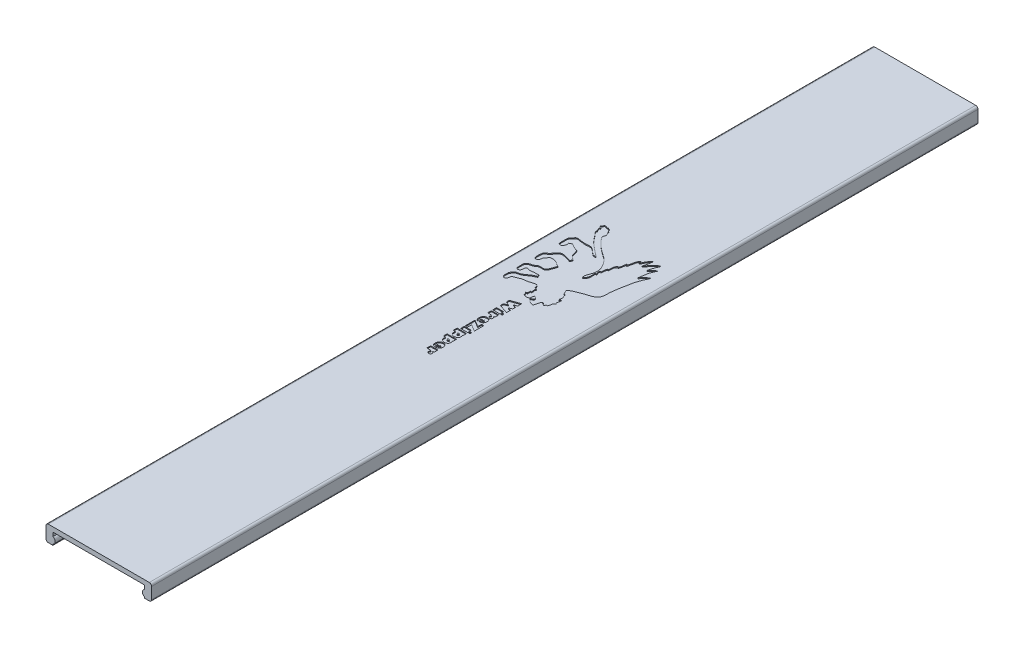
from build123d import *

# Parameters (mm, degrees)
BOSS_EXTRUDE1_DEPTH = 180
CUT_EXTRUDE1_DEPTH  = 0.2
CUT_EXTRUDE3_DEPTH  = 0.2


with BuildPart() as part:
    # Sketch1 → Boss-Extrude1 (new body)
    with BuildSketch(Plane.XY):
        with BuildLine():
            Line((21.5, 0), (22.5, 0))
            ThreePointArc((22.5, 0), (22.853553391, 0.146446609), (23, 0.5))
            Line((23, 0.5), (23, 3))
            ThreePointArc((23, 3), (22.853553391, 3.353553391), (22.5, 3.5))
            Line((22.5, 3.5), (0.5, 3.5))
            ThreePointArc((0.5, 3.5), (0.146446609, 3.353553391), (0, 3))
            Line((0, 3), (0, 0.5))
            ThreePointArc((0, 0.5), (0.146446609, 0.146446609), (0.5, 0))
            Line((0.5, 0), (1.5, 0))
            Line((1.5, 0), (1.5, 0.22281926))
            ThreePointArc((1.5, 0.22281926), (2, 0.929926042), (1.5, 1.637032823))
            Line((1.5, 1.637032823), (1.5, 2.5))
            Line((1.5, 2.5), (21.5, 2.5))
            Line((21.5, 2.5), (21.5, 1.637032823))
            ThreePointArc((21.5, 1.637032823), (21, 0.929926042), (21.5, 0.22281926))
            Line((21.5, 0.22281926), (21.5, 0))
        make_face()
    extrude(amount=BOSS_EXTRUDE1_DEPTH)

    # Sketch2 → Cut-Extrude1 (cut)
    with BuildSketch(Plane(origin=(0, 3.5, 0), x_dir=(1, 0, 0), z_dir=(0, 1, 0))):
        Polygon((19.745567043, -68.104601105), (19.771329957, -68.016192319), (19.70560115, -68.038746064), (19.64138336, -68.063779757), (19.578619421, -68.091182355), (19.517252165, -68.120842815), (19.457224424, -68.152650096), (19.39847903, -68.186493155), (19.340958816, -68.22226095), (19.284606615, -68.25984244), (19.229365259, -68.299126581), (19.175177579, -68.340002332), (19.12198641, -68.382358651), (19.069734583, -68.426084496), (19.018364931, -68.471068823), (18.918043479, -68.564368759), (18.772748422, -68.710981234), (18.269777505, -69.271361386), (18.281217218, -69.152948654), (18.534959056, -67.569138215), (18.544005901, -67.509503112), (18.554730191, -67.450416977), (18.56703761, -67.391848979), (18.580833842, -67.333768285), (18.612515474, -67.218945481), (18.649020551, -67.105701905), (18.711171581, -66.93825803), (19.047435047, -66.172036884), (19.133726594, -65.94994016), (19.076628488, -65.960005663), (19.0210055, -65.972912087), (18.966794939, -65.988522881), (18.913934115, -66.006701499), (18.862360336, -66.027311391), (18.812010911, -66.05021601), (18.762823149, -66.075278807), (18.71473436, -66.102363235), (18.667681851, -66.131332743), (18.621602933, -66.162050786), (18.576434914, -66.194380813), (18.532115103, -66.228186277), (18.445769342, -66.299677323), (18.362064121, -66.375431536), (18.200569188, -66.535359923), (17.84770658, -66.896305725), (17.884657267, -66.736955957), (17.968344054, -66.421133138), (18.063839559, -66.108907692), (18.225973101, -65.646689184), (18.633040198, -64.666178627), (18.599411796, -64.669771971), (18.533227498, -64.680575674), (18.468456628, -64.695924518), (18.405079291, -64.715485446), (18.312582633, -64.751995932), (18.2231095, -64.796110162), (18.080524168, -64.883478066), (17.794211119, -65.113398916), (17.069099288, -65.909145003), (16.828722484, -66.241607928), (16.513006588, -66.656341035), (16.794160411, -65.369006265), (16.941861286, -64.59631034), (16.870777867, -64.636264025), (16.802816891, -64.679249232), (16.737833191, -64.725113573), (16.675681599, -64.773704659), (16.616216947, -64.824870101), (16.559294067, -64.87845751), (16.504767792, -64.934314498), (16.452492954, -64.992288676), (16.402324385, -65.052227654), (16.354116917, -65.113979045), (16.307725383, -65.177390459), (16.263004615, -65.242309509), (16.219809445, -65.308583804), (16.177994705, -65.376060956), (16.097925845, -65.514014276), (15.98454659, -65.726155966), (15.693970925, -66.293387042), (15.617711182, -66.428936729), (15.54903134, -65.848423204), (15.522460267, -65.865064365), (15.472343148, -65.901302245), (15.426048379, -65.941194805), (15.383322735, -65.984398764), (15.34391299, -66.030570845), (15.290461754, -66.104643271), (15.228435653, -66.210590997), (15.076480483, -66.580017015), (15.040869472, -66.693542611), (14.686293126, -68.258406048), (14.474940792, -67.937489416), (14.445551284, -68.104829917), (14.310577684, -68.947591988), (14.271183579, -69.113223294), (14.240015457, -69.222374291), (14.204192452, -69.330305289), (14.163088355, -69.436841345), (14.140360206, -69.489531601), (14.116076957, -69.541807517), (13.981394714, -69.409464834), (13.758050972, -69.632820298), (13.676716055, -69.754194358), (13.642544144, -69.830846835), (13.624269592, -69.89243466), (13.614813809, -69.932350891), (13.591969798, -70.052722709), (13.568864821, -70.255035201), (13.529664818, -71.070500793), (13.334094675, -70.96058259), (13.302168255, -71.042533388), (13.24802945, -71.209136729), (13.206156478, -71.378791597), (13.169809605, -71.594144463), (13.14752875, -71.855680811), (13.149463132, -72.206015635), (12.963703448, -72.245338409), (12.919499216, -72.274044131), (12.898916729, -72.298983789), (12.888280793, -72.319488077), (12.880455427, -72.34346579), (12.874040289, -72.372947136), (12.865584292, -72.431757942), (12.862523692, -72.490347444), (12.864334122, -72.548693093), (12.870491214, -72.606772342), (12.893747912, -72.722041444), (13.055767611, -73.167952174), (12.76260984, -73.058920113), (12.772836021, -74.2235194), (12.769441063, -74.267985594), (12.764247026, -74.311940293), (12.757306122, -74.355374587), (12.748670559, -74.398279565), (12.738392549, -74.440646318), (12.7265243, -74.482465934), (12.713118023, -74.523729503), (12.698225927, -74.564428116), (12.681900222, -74.604552862), (12.664193119, -74.644094829), (12.624843556, -74.721394791), (12.580594918, -74.796256719), (12.531864882, -74.868609329), (12.479071129, -74.938381339), (12.422631337, -75.005501468), (12.332049001, -75.10105345), (12.235612524, -75.190237731), (12.134731573, -75.272813733), (12.046286421, -74.820815745), (12.0572263, -74.751406038), (12.070060076, -74.682497303), (12.08463885, -74.614050506), (12.100813721, -74.546026613), (12.137356163, -74.411091404), (12.200418082, -74.210884521), (12.455179307, -73.483307548), (12.495149159, -73.349414391), (12.530187067, -73.214246266), (12.545484294, -73.146086506), (12.559101837, -73.077490902), (12.570890798, -73.008420419), (12.580702278, -72.938836025), (12.588387376, -72.868698685), (12.59464246, -72.810642899), (12.603824389, -72.694131792), (12.608519809, -72.577268101), (12.608670092, -72.460267982), (12.604216612, -72.343347591), (12.595100741, -72.226723086), (12.581263852, -72.110610622), (12.562647316, -71.995226355), (12.539192508, -71.880786442), (12.510840798, -71.767507038), (12.47753356, -71.655604302), (12.439212167, -71.545294387), (12.39581799, -71.436793452), (12.347292403, -71.330317652), (12.293576778, -71.226083144), (12.153611462, -70.972593632), (12.055622325, -70.8055721), (11.953676271, -70.640627802), (11.847590064, -70.478189353), (11.737180466, -70.318685371), (11.622264242, -70.162544472), (11.563058883, -70.085869122), (11.502658155, -70.010195274), (11.441039151, -69.935576505), (11.378178968, -69.862066392), (11.314054701, -69.789718512), (11.248643446, -69.718586443), (11.181922298, -69.648723762), (11.113868352, -69.580184045), (11.044458704, -69.513020869), (10.973670449, -69.447287813), (10.901480682, -69.383038452), (10.8278665, -69.320326365), (10.752804998, -69.259205127), (10.676273271, -69.199728316), (10.598248414, -69.14194951), (10.518707523, -69.085922285), (9.445158783, -68.330045283), (9.377323265, -68.286704215), (8.529964041, -67.61150044), (8.336111467, -67.454739788), (8.147528972, -67.291868199), (7.90408908, -67.065842996), (7.669551492, -66.830496664), (7.443649508, -66.586710778), (7.173009545, -66.271453322), (6.864769026, -65.879980377), (6.709729802, -65.656858788), (6.656644684, -65.543795663), (6.640724685, -65.474324633), (6.637953976, -65.419306649), (6.637039488, -65.393399508), (6.637876621, -65.367752405), (6.640315856, -65.342344663), (6.649402561, -65.292164545), (6.663103453, -65.24269372), (6.767484106, -64.975890107), (6.787730528, -64.902361955), (6.795283594, -64.852609955), (6.796828208, -64.827451949), (6.796685517, -64.802078367), (6.794706002, -64.77646853), (6.790740146, -64.75060176), (6.78463843, -64.724457376), (6.776251336, -64.698014701), (6.478949583, -63.833852049), (6.316198754, -63.871944585), (6.081407246, -63.266668763), (5.943714714, -63.442255947), (5.617870925, -63.080333737), (5.499302591, -63.247135679), (5.418185032, -63.212665539), (5.083167801, -63.109789756), (4.852038362, -63.078852692), (4.675548278, -63.079290725), (4.667182278, -63.332341528), (4.3028609, -63.683744915), (4.436380901, -63.74543469), (4.682235799, -63.862000094), (4.740558774, -63.903978471), (4.775654331, -63.93618192), (4.807122862, -63.972386928), (4.821336845, -63.992158035), (4.834451894, -64.013131153), (4.846403949, -64.035373491), (4.857128952, -64.058952255), (4.866562843, -64.083934652), (4.619415738, -64.138096574), (4.636424293, -64.21830065), (4.696572924, -64.397852828), (4.954743423, -64.842439101), (4.882509129, -65.057092669), (4.880850914, -65.175763412), (4.901269108, -65.22048276), (4.962643763, -65.325273315), (5.32889596, -65.714175511), (5.354305854, -65.737196295), (5.426177903, -65.809786685), (5.534157903, -65.940347595), (5.924220438, -66.497400316), (5.994118086, -66.591179891), (6.065464319, -66.683663429), (6.138209009, -66.774888771), (6.212302028, -66.86489376), (6.287693249, -66.953716237), (6.364332545, -67.041394044), (6.442169787, -67.127965023), (6.521154849, -67.213467015), (6.601237603, -67.297937861), (6.764495676, -67.463937487), (6.931542986, -67.626266632), (7.101978513, -67.785228032), (7.275401236, -67.94112442), (7.540259084, -68.169884333), (8.356211579, -68.829090573), (8.39965809, -68.870721216), (8.488690302, -68.951152824), (8.626852738, -69.065704523), (8.914944993, -69.279321314), (9.595664905, -69.767475131), (9.73351794, -69.882958951), (9.238387712, -69.912079265), (9.122579566, -69.898059871), (9.054333719, -69.880159565), (8.905920839, -69.767554214), (7.90154777, -68.93355232), (7.651348823, -68.749684369), (7.602203888, -68.718777787), (7.552316259, -68.691274341), (7.501727456, -68.667008821), (7.450479005, -68.645816018), (7.398612426, -68.627530719), (7.346169242, -68.611987715), (7.293190978, -68.599021796), (7.239719154, -68.588467749), (7.185795294, -68.580160366), (7.13146092, -68.573934435), (7.076757555, -68.569624746), (7.021726722, -68.567066089), (6.910848742, -68.566541025), (6.743113827, -68.5747559), (6.185203457, -68.626466799), (6.076335393, -68.631387665), (4.991956592, -68.53259847), (4.861058435, -68.514729341), (4.366578875, -68.439300904), (4.267682616, -68.437779177), (4.201866854, -68.441828587), (4.136175391, -68.450643686), (4.070635862, -68.464836967), (4.037931708, -68.474141829), (4.01404608, -68.482781016), (3.991237496, -68.492646738), (3.969449153, -68.503673451), (3.92870599, -68.528947679), (3.891362185, -68.558079357), (3.856963332, -68.590544139), (3.780868317, -68.68284742), (3.574977655, -68.983157009), (3.510176489, -69.065065577), (3.25557439, -69.337636123), (3.211351075, -69.401747679), (3.186726578, -69.44712548), (3.166822765, -69.495060225), (3.158864646, -69.520106327), (3.152354934, -69.545935514), (3.147383041, -69.572595737), (3.14403838, -69.600134946), (3.139952782, -69.65652541), (3.140584749, -71.23861477), (3.144107239, -71.277524794), (3.183718199, -71.405349389), (3.229265505, -71.469694649), (3.269232129, -71.502636865), (3.304427669, -71.520476277), (3.344216436, -71.53134745), (3.61837653, -71.551970824), (3.709675015, -71.543297562), (3.775331899, -71.528081984), (3.817132856, -71.512976279), (3.856966272, -71.493394454), (3.894496742, -71.468902338), (3.91229356, -71.454679244), (3.929388866, -71.439065763), (3.945740734, -71.422007625), (3.961307239, -71.403450559), (3.98937849, -71.373627764), (4.015892902, -71.342811256), (4.040860808, -71.311051795), (4.064292537, -71.278400145), (4.086198421, -71.244907065), (4.106588791, -71.210623319), (4.125473977, -71.175599669), (4.142864311, -71.139886875), (4.158770122, -71.1035357), (4.173201743, -71.066596906), (4.186169503, -71.029121254), (4.197683734, -70.991159506), (4.207754767, -70.952762424), (4.216392932, -70.91398077), (4.223608561, -70.874865306), (4.233813531, -70.795835993), (4.238452325, -70.71608058), (4.237607589, -70.636005163), (4.23136197, -70.556015834), (4.219798116, -70.476518688), (4.202998672, -70.397919821), (4.181046286, -70.320625326), (4.790131131, -70.048376237), (5.224468095, -70.346633618), (5.475077196, -70.486742868), (5.64836071, -70.567299985), (5.78185668, -70.619673541), (5.91856101, -70.664295823), (6.011559556, -70.689357225), (6.441244971, -70.804155975), (6.680255914, -71.473471612), (6.700440152, -71.528410734), (6.744214516, -71.698966386), (6.8305612, -72.101378224), (6.861817271, -72.18289268), (6.887686976, -72.235415575), (6.918328723, -72.286218549), (6.970050687, -72.344544556), (7.108551306, -72.480415089), (7.793872115, -72.991890375), (7.735132038, -73.15174023), (7.645154274, -73.31873513), (7.592514427, -73.38335033), (7.546532614, -73.426319923), (7.494231265, -73.463718165), (7.455521087, -73.485171093), (6.985274076, -73.317712497), (6.413893192, -73.140189722), (6.218812671, -73.098385977), (6.070290228, -73.075536206), (6.002042209, -73.066146668), (5.611704265, -73.021744922), (5.505306074, -73.022135986), (5.435448501, -73.027843033), (5.366821867, -73.038771649), (5.333069605, -73.046425607), (5.299744422, -73.055662833), (5.266886098, -73.06657595), (5.234534417, -73.079257584), (5.202729158, -73.093800359), (5.171510104, -73.110296901), (5.140917036, -73.128839834), (5.110989736, -73.149521784), (5.081767984, -73.172435374), (5.038848794, -73.208166122), (4.914287773, -73.319608788), (4.718279149, -73.517061407), (3.986003167, -74.357903796), (3.433483796, -74.798544394), (3.243243612, -74.988383245), (3.204221159, -75.132149523), (3.132588262, -75.845942829), (3.130799477, -76.252818038), (3.148654304, -76.422002715), (3.168852255, -76.521067461), (3.187151588, -76.585602228), (3.209812025, -76.648656325), (3.237256891, -76.709994933), (3.269909511, -76.769383233), (3.288321017, -76.798272638), (3.329155607, -76.818994217), (3.393163804, -76.84288409), (3.45976748, -76.858628273), (3.551225161, -76.86789309), (3.643973908, -76.864941433), (3.781363878, -76.840439001), (3.931373466, -76.786619478), (3.950191496, -76.76983757), (3.967597017, -76.752250032), (3.983658702, -76.733899947), (4.012025244, -76.695084471), (4.035840485, -76.653735812), (4.055653791, -76.610198638), (4.085472057, -76.517937421), (4.154540692, -76.130285695), (4.157762673, -76.099856406), (4.162628318, -76.070279244), (4.169049296, -76.041508503), (4.176937276, -76.013498481), (4.196760928, -75.959577778), (4.221392631, -75.908151502), (4.265809513, -75.834889324), (4.488060664, -75.565058469), (4.592547696, -75.426797706), (4.768640496, -75.176910233), (4.823399979, -75.126278587), (4.869821171, -75.095667931), (4.903789049, -75.079559916), (4.940466976, -75.067384508), (4.98010671, -75.059564567), (5.021954842, -75.04726225), (5.063804833, -75.037016268), (5.105652668, -75.028734313), (5.147494334, -75.022324076), (5.189325817, -75.017693247), (5.231143104, -75.014749518), (5.272942181, -75.01340058), (5.314719033, -75.013554125), (5.398190011, -75.017999424), (5.481523927, -75.027346945), (5.606197568, -75.048944486), (6.179790772, -75.200372854), (6.239633866, -75.219128046), (6.296962677, -75.242394957), (6.379011919, -75.284391349), (6.533269842, -75.386216596), (6.862349187, -75.617843215), (6.945037614, -75.659721778), (7.352869278, -75.847349819), (7.335319283, -75.927703013), (7.254192511, -76.202650419), (6.985260636, -76.976985108), (6.921800835, -77.174822227), (6.841723584, -77.37132666), (6.79270217, -77.464611689), (6.755947017, -77.523748635), (6.715552076, -77.579825402), (6.671191275, -77.632312519), (6.647421778, -77.657044497), (6.622538539, -77.680680511), (6.596500797, -77.703154375), (6.569267795, -77.724399905), (6.540798772, -77.744350918), (6.511052969, -77.76294123), (6.479989628, -77.780104655), (6.447567989, -77.795775011), (6.40560176, -77.808651938), (6.363432271, -77.819535485), (6.321073302, -77.828565942), (6.278538629, -77.835883599), (6.235842032, -77.841628747), (6.150018177, -77.848962676), (6.020412416, -77.85167701), (5.541917787, -77.834166794), (5.41216609, -77.838595989), (5.326210196, -77.84748146), (5.283437156, -77.854124869), (5.240819091, -77.862422447), (5.198369779, -77.872514485), (5.142932417, -77.892932147), (5.037240988, -77.94319646), (4.595508909, -78.232665262), (4.465771592, -78.301295382), (4.414079725, -78.328559934), (4.360843257, -78.35123264), (4.250771412, -78.385854041), (3.854897238, -78.474529346), (3.773689965, -78.503975684), (3.721286266, -78.528674252), (3.670571997, -78.55831699), (3.616155246, -78.595331521), (3.217410772, -79.00059091), (3.19317992, -79.036269035), (3.173696418, -79.073379124), (3.152297456, -79.131367032), (3.135794606, -79.212150909), (3.130301383, -79.59056065), (3.131677235, -79.625378652), (3.13515924, -80.361202792), (3.153164243, -80.499456743), (3.175475562, -80.602089762), (3.194897118, -80.632702863), (3.216551099, -80.660694146), (3.240262865, -80.686093336), (3.265857778, -80.70893016), (3.2931612, -80.729234343), (3.32199849, -80.747035611), (3.35219501, -80.762363689), (3.383576122, -80.775248304), (3.415967186, -80.785719181), (3.449193564, -80.793806045), (3.483080616, -80.799538623), (3.517453704, -80.80294664), (3.552138188, -80.804059822), (3.586959431, -80.802907895), (3.621742792, -80.799520584), (3.656313633, -80.793927616), (3.690497316, -80.786158715), (3.724119201, -80.776243608), (3.757004649, -80.76421202), (3.788979022, -80.750093677), (3.819867681, -80.733918305), (3.849495986, -80.71571563), (3.877689299, -80.695515377), (3.90427298, -80.673347272), (3.929072392, -80.649241041), (3.951912895, -80.62322641), (3.97261985, -80.595333103), (3.991018618, -80.565590848), (4.006934561, -80.534029369), (4.026658772, -80.468509876), (4.041958321, -80.401577975), (4.093602475, -79.987461307), (4.118134233, -79.851994599), (4.136012084, -79.786120475), (4.158887552, -79.72189382), (4.17249384, -79.690493915), (4.187702868, -79.659620623), (4.204632414, -79.629312193), (4.223400257, -79.599606872), (4.244124176, -79.57054291), (4.294322886, -79.560046044), (4.394477249, -79.549496262), (4.519018866, -79.553175896), (4.956959152, -79.660275724), (4.993137986, -79.67044278), (5.029338755, -79.678827737), (5.06556032, -79.685532985), (5.10180154, -79.690660915), (5.138061278, -79.694313918), (5.210631748, -79.697604709), (5.283262616, -79.696224487), (5.392302227, -79.687187846), (5.901775676, -79.611653552), (6.010888162, -79.605724838), (6.910724574, -79.583092112), (7.079993608, -79.979697301), (6.960640786, -80.018349236), (6.843254235, -80.061514076), (6.727725219, -80.108861548), (6.557676714, -80.187002723), (6.391196025, -80.272697043), (6.17413742, -80.396778888), (5.497482708, -80.847161933), (5.050235161, -81.163132955), (4.845481788, -81.276636507), (4.702724052, -81.339200331), (4.591832195, -81.377593303), (4.515905719, -81.398582916), (3.962451456, -81.509870343), (3.836287705, -81.55399255), (3.763557986, -81.589752309), (3.421766696, -82.024454199), (3.230115071, -82.262994818), (3.189620962, -82.341215118), (3.174230893, -82.391897064), (3.168589007, -82.427579253), (3.16714966, -82.464962643), (3.169082441, -83.369377327), (3.171152539, -83.404791173), (3.176253231, -83.439743518), (3.184234647, -83.474111917), (3.194946916, -83.507773927), (3.208240169, -83.540607104), (3.223964534, -83.572489007), (3.241970142, -83.60329719), (3.262107121, -83.632909211), (3.284225601, -83.661202627), (3.308175713, -83.688054993), (3.333807585, -83.713343867), (3.360971347, -83.736946806), (3.389517129, -83.758741365), (3.41929506, -83.778605102), (3.45015527, -83.796415573), (3.481947888, -83.812050335), (3.514523044, -83.825386944), (3.547730868, -83.836302957), (3.581421489, -83.844675931), (3.615445037, -83.850383422), (3.649651641, -83.853302987), (3.683891431, -83.853312183), (3.718014536, -83.850288566), (3.751871086, -83.844109693), (3.785311211, -83.834653121), (3.81818504, -83.821796405), (3.850342703, -83.805417104), (3.881634329, -83.785392772), (3.911910048, -83.761600968), (3.941627115, -83.738549129), (3.968555703, -83.714125817), (3.992849747, -83.688409762), (4.014663184, -83.66147969), (4.034149948, -83.633414329), (4.051463973, -83.604292407), (4.066759197, -83.574192652), (4.080189553, -83.543193792), (4.091908977, -83.511374553), (4.102071403, -83.478813665), (4.110830768, -83.445589854), (4.124756052, -83.377468376), (4.162536714, -83.023853064), (4.178529719, -82.921216849), (4.194234668, -82.855645098), (4.204061831, -82.823951123), (5.709166827, -82.208816781), (5.745468392, -82.195717217), (5.818706943, -82.173175852), (5.929944577, -82.147271155), (6.156009482, -82.115763661), (6.687170783, -82.058997138), (6.798940154, -82.033761003), (6.921100642, -82.008515318), (7.102783459, -81.963377734), (7.942165958, -81.715913405), (8.123883521, -81.672704643), (8.246073986, -81.64912304), (8.369302006, -81.630693129), (8.431358997, -81.623670497), (8.493740054, -81.618248314), (8.556466735, -81.614530755), (8.872641196, -82.023266092), (8.847383583, -82.360020721), (9.365290519, -82.508550236), (9.235963053, -82.755180236), (9.30174099, -82.920386313), (9.291343064, -82.965881161), (9.283217409, -83.033851223), (9.283864284, -83.124082108), (9.357134099, -83.57422359), (9.058292573, -83.474445045), (9.070313767, -84.164851175), (8.674314613, -84.279138404), (9.075376023, -84.693660343), (9.004267543, -84.946211574), (9.797893144, -85.091875963), (10.299309972, -84.918726798), (10.302590804, -84.888892866), (10.362134706, -84.257198502), (10.392402408, -84.140493295), (10.4238157, -84.054795842), (10.452761583, -84.053395865), (10.48270627, -84.054232149), (10.513454488, -84.057230867), (10.544810964, -84.062318192), (10.576580425, -84.069420299), (10.608567599, -84.078463359), (10.640577212, -84.089373546), (10.672413991, -84.102077034), (10.703882664, -84.116499996), (10.734787958, -84.132568605), (10.764934599, -84.150209034), (10.794127315, -84.169347457), (10.822170833, -84.189910047), (10.84886988, -84.211822978), (10.874029183, -84.235012421), (10.897453468, -84.259404552), (10.918947464, -84.284925543), (10.938315897, -84.311501567), (10.955363494, -84.339058797), (10.969894983, -84.367523408), (10.98171509, -84.396821571), (10.990628542, -84.426879461), (10.996440067, -84.457623251), (10.998954391, -84.488979114), (10.997976242, -84.520873223), (10.993310347, -84.553231752), (10.984761433, -84.585980873), (10.972134227, -84.619046761), (10.955233455, -84.652355588), (10.946900708, -84.675901271), (10.937122571, -84.697505549), (10.925975944, -84.717267722), (10.913537725, -84.735287091), (10.899884813, -84.751662955), (10.885094105, -84.766494615), (10.869242501, -84.779881371), (10.852406898, -84.791922524), (10.834664196, -84.802717374), (10.796765085, -84.820965366), (10.735035629, -84.841472587), (10.468766526, -84.891767434), (10.407742715, -84.909813177), (10.632654551, -85.215101293), (10.856289859, -85.482768493), (10.94391904, -85.559685488), (11.007478361, -85.597529103), (11.238912997, -85.713053186), (11.51691899, -85.814885234), (11.949543592, -85.913752266), (12.142914428, -85.340516337), (12.268622202, -84.704727993), (12.270172263, -84.682613028), (12.273394104, -84.661654343), (12.278202913, -84.641799733), (12.284513875, -84.622996995), (12.292242176, -84.605193922), (12.301303003, -84.588338312), (12.32308298, -84.55726066), (12.349175294, -84.529346403), (12.378901438, -84.504177905), (12.428819842, -84.470659881), (12.682407584, -84.342088626), (12.736615276, -84.712836608), (13.058275473, -84.546878528), (13.138678392, -84.839029217), (13.15619516, -84.830826961), (13.188655655, -84.812000098), (13.231520718, -84.778313524), (13.27949892, -84.724938588), (13.440817098, -84.41633767), (13.632120999, -84.500552553), (13.75384145, -84.259790443), (13.818074028, -84.056258307), (13.84273201, -83.897648818), (13.845714599, -83.761784673), (13.855415492, -83.734454161), (13.889406923, -83.655010608), (13.944616533, -83.554313431), (14.320152096, -83.076569037), (14.06605127, -82.885197209), (14.098786875, -82.818870429), (14.141116363, -82.717192121), (14.175841778, -82.613213385), (14.211333893, -82.471629225), (14.244252884, -82.254702703), (14.255583412, -81.85169457), (13.769921082, -82.077886878), (13.767131001, -81.988319314), (13.774855998, -81.869942166), (13.859551467, -81.343553664), (13.863599826, -81.226018561), (13.63271354, -80.803171682), (13.598279053, -80.702891724), (13.581417493, -80.624274459), (13.575291626, -80.569914619), (13.573784579, -80.513793389), (13.044000725, -80.267249877), (13.143231585, -80.107359869), (12.879349072, -79.691964097), (12.846268149, -79.593671721), (12.895346802, -79.536538831), (13.133480095, -79.294607686), (13.308790367, -79.152128919), (13.465607452, -79.048500383), (13.598379918, -78.977255637), (13.702367947, -78.93144955), (15.214345303, -78.327294979), (15.618309027, -78.185406688), (15.863997926, -78.109643113), (16.029493375, -78.063956105), (16.35909275, -77.961655427), (16.624715944, -77.868975237), (16.755920195, -77.817254558), (16.884959432, -77.761089918), (16.948410893, -77.731140275), (17.011013567, -77.699838637), (17.072664943, -77.667104669), (17.13326251, -77.632858035), (17.192703758, -77.597018403), (17.250886175, -77.559505435), (17.307707249, -77.520238797), (17.363064471, -77.479138156), (17.416855329, -77.436123174), (17.468977312, -77.391113518), (17.519327909, -77.344028853), (17.567804609, -77.294788844), (17.614304901, -77.243313156), (17.658726274, -77.189521454), (17.700966217, -77.133333402), (17.740922218, -77.074668667), (17.768709081, -77.008887079), (17.794040451, -76.942566934), (17.817040611, -76.87573761), (17.837833847, -76.808428488), (17.856544442, -76.740668949), (17.873296682, -76.672488371), (17.888214851, -76.603916135), (17.901423233, -76.534981622), (17.913046113, -76.46571421), (17.923207776, -76.396143281), (17.939644586, -76.256208387), (17.95172794, -76.115411982), (17.984800059, -75.336135569), (18.0039464, -75.055702584), (18.21790855, -73.436569234), (18.646280749, -71.241641808), (18.668328165, -71.098314098), (18.694877755, -70.956082083), (18.74224461, -70.744591426), (18.817321843, -70.465598008), (19.238999652, -69.233892702), (19.288145915, -69.10518097), (19.568730961, -68.526840663), (19.699700683, -68.234226031), align=None)
    extrude(amount=-CUT_EXTRUDE1_DEPTH, mode=Mode.SUBTRACT)

    # Sketch4 → Cut-Extrude3 (cut)
    # profile 1 of 12: a face of its own
    with BuildSketch(Plane(origin=(0, 3.5, 0), x_dir=(1, 0, 0), z_dir=(0, 1, 0))):
        Polygon((8.493740054, -88.238951439), (8.493740054, -87.581529564), (10.493740054, -86.868248314), (10.493740054, -87.740123314), (9.841005679, -87.974498314), (10.493740054, -88.220592064), (10.493740054, -88.840904564), (9.841005679, -89.099107689), (10.493740054, -89.319810814), (10.493740054, -90.193248314), (8.493740054, -89.513170189), (8.493740054, -88.854185814), (9.290224429, -88.535435814), align=None)
    # profile 2 of 12: a face of its own
    with BuildSketch(Plane(origin=(0, 3.5, 0), x_dir=(1, 0, 0), z_dir=(0, 1, 0))):
        with BuildLine():
            add(Edge.make_bspline(
                [(10.068740054, -90.939342064), (10.069574094, -90.924411079), (10.071221442, -90.894920252), (10.084096682, -90.85253902), (10.105515009, -90.813572169), (10.13462238, -90.779061513), (10.169201583, -90.749807501), (10.208321787, -90.728716427), (10.250593047, -90.715581386), (10.279973554, -90.713982921), (10.294911929, -90.713170189)],
                knots=[0, 0, 0, 0, 1.009378599, 1.993666835, 2.967841641, 4.000348654, 5.032855666, 6.014773643, 6.990621401, 8, 8, 8, 8], degree=3))
            add(Edge.make_bspline(
                [(10.294911929, -90.713170189), (10.309849642, -90.713985702), (10.339228849, -90.715589637), (10.381399294, -90.728650444), (10.420219205, -90.749713808), (10.454044033, -90.779224021), (10.482824898, -90.813564684), (10.503671884, -90.852650688), (10.516771828, -90.894886537), (10.518078671, -90.924403671), (10.518740054, -90.939342064)],
                knots=[0, 0, 0, 0, 1.0134126, 1.993160351, 2.971228465, 3.994329448, 5.02532064, 5.999176987, 6.98739895, 8, 8, 8, 8], degree=3))
            add(Edge.make_bspline(
                [(10.518740054, -90.939342064), (10.518096824, -90.954286498), (10.516831235, -90.983690502), (10.503555018, -91.025726236), (10.48303268, -91.064624084), (10.454017161, -91.098366771), (10.419966038, -91.12693776), (10.381495659, -91.148225527), (10.339148091, -91.160620054), (10.309834932, -91.162309905), (10.294911929, -91.163170189)],
                knots=[0, 0, 0, 0, 1.017177303, 2.001352833, 2.979610333, 4.001591882, 5.017875578, 6.00036388, 6.98200748, 8, 8, 8, 8], degree=3))
            add(Edge.make_bspline(
                [(10.294911929, -91.163170189), (10.279988196, -91.162312727), (10.250673605, -91.160628419), (10.208225618, -91.148160884), (10.169452081, -91.126839813), (10.134654283, -91.098527968), (10.105305336, -91.064619761), (10.084214637, -91.025837174), (10.071160977, -90.983656969), (10.069556064, -90.954279098), (10.068740054, -90.939342064)],
                knots=[0, 0, 0, 0, 1.013893472, 1.991584386, 2.977894406, 4.003775212, 5.027361664, 6.005893879, 6.986106528, 8, 8, 8, 8], degree=3))
        make_face()
    # profile 3 of 12: a face of its own
    with BuildSketch(Plane(origin=(0, 3.5, 0), x_dir=(1, 0, 0), z_dir=(0, 1, 0))):
        with BuildLine():
            Line((10.093740054, -91.168248314), (8.493740054, -91.168248314))
            Line((8.493740054, -91.168248314), (8.493740054, -90.343248314))
            Line((8.493740054, -90.343248314), (10.093740054, -90.343248314))
            add(Edge.make_bspline(
                [(10.093740054, -90.343248314), (10.085669549, -90.357176008), (10.069295049, -90.385434345), (10.049184388, -90.431063999), (10.032035076, -90.479526635), (10.017889582, -90.531084339), (10.007110167, -90.585670212), (9.999370507, -90.643198791), (9.994569345, -90.703713317), (9.994021421, -90.745062022), (9.993740054, -90.766295189)],
                knots=[0, 0, 0, 0, 0.877200649, 1.779780104, 2.71397693, 3.67857263, 4.692272687, 5.74560382, 6.842334481, 8, 8, 8, 8], degree=3))
            add(Edge.make_bspline(
                [(9.993740054, -90.766295189), (9.994027934, -90.785966369), (9.994593104, -90.824585023), (9.999394978, -90.881326011), (10.007086156, -90.935613966), (10.017982965, -90.98731545), (10.032089363, -91.036403198), (10.04923681, -91.082917028), (10.069486362, -91.127032058), (10.085692482, -91.154572426), (10.093740054, -91.168248314)],
                knots=[0, 0, 0, 0, 1.124996517, 2.208604206, 3.254495079, 4.25946492, 5.228266681, 6.173185239, 7.092847464, 8, 8, 8, 8], degree=3))
        make_face()
    # profile 4 of 12: a face of its own
    with BuildSketch(Plane(origin=(0, 3.5, 0), x_dir=(1, 0, 0), z_dir=(0, 1, 0))):
        with BuildLine():
            add(Edge.make_bspline(
                [(9.745693179, -92.293248314), (9.760875817, -92.299719311), (9.790525967, -92.31235651), (9.832696352, -92.333737721), (9.872297627, -92.355355836), (9.908739612, -92.378574934), (9.942416438, -92.40264351), (9.973011111, -92.428195153), (10.000731026, -92.454643013), (10.025571869, -92.482175451), (10.047513946, -92.510779716), (10.066802531, -92.540452795), (10.082797829, -92.571365428), (10.095873764, -92.603400164), (10.105886237, -92.636518496), (10.113443129, -92.670573103), (10.117781303, -92.705766644), (10.118416521, -92.729564801), (10.118740054, -92.741685814)],
                knots=[0, 0, 0, 0, 1.272947967, 2.485937938, 3.646070252, 4.752461798, 5.817491216, 6.837459618, 7.825055744, 8.771109415, 9.695364672, 10.603761161, 11.49788128, 12.376517629, 13.269451874, 14.164023341, 15.064889935, 16, 16, 16, 16], degree=3))
            add(Edge.make_bspline(
                [(10.118740054, -92.741685814), (10.118477903, -92.755112375), (10.117964331, -92.781415923), (10.112819734, -92.819911504), (10.104028082, -92.856441979), (10.092646022, -92.891525649), (10.076493253, -92.924247653), (10.058420284, -92.955983379), (10.03583506, -92.985147237), (10.010495979, -93.012499445), (9.982661173, -93.037268527), (9.952624308, -93.059099974), (9.920732868, -93.077290312), (9.887001835, -93.092400268), (9.851537136, -93.104103035), (9.814078804, -93.112176531), (9.77488368, -93.117512592), (9.748055172, -93.117999734), (9.734365054, -93.118248314)],
                knots=[0, 0, 0, 0, 1.068321857, 2.092915352, 3.083392302, 4.056803988, 5.021068689, 5.982711963, 6.959043587, 7.949086641, 8.947502873, 9.919810416, 10.899382301, 11.864370819, 12.857447167, 13.865819438, 14.91096497, 16, 16, 16, 16], degree=3))
            add(Edge.make_bspline(
                [(9.734365054, -93.118248314), (9.720155493, -93.117995813), (9.692291869, -93.117500682), (9.651656929, -93.112227728), (9.613083737, -93.104084669), (9.576596981, -93.092707128), (9.541937001, -93.078291464), (9.509517784, -93.060244068), (9.479071804, -93.038983919), (9.451273383, -93.014409143), (9.425675316, -92.987615142), (9.403907247, -92.958211567), (9.385250927, -92.926966317), (9.370067293, -92.893827688), (9.358269305, -92.858583383), (9.349696951, -92.821453035), (9.344507359, -92.782197809), (9.343999305, -92.755373692), (9.343740054, -92.741685814)],
                knots=[0, 0, 0, 0, 1.116703655, 2.189751872, 3.215862479, 4.213223321, 5.190572813, 6.162113662, 7.124984703, 8.104476803, 9.074992165, 10.033280158, 10.974405702, 11.931872986, 12.893436813, 13.891795567, 14.924220135, 16, 16, 16, 16], degree=3))
            add(Edge.make_bspline(
                [(9.343740054, -92.741685814), (9.344212327, -92.726037817), (9.345145432, -92.695120923), (9.351915209, -92.649536984), (9.363169536, -92.605618686), (9.379359773, -92.563646755), (9.399913888, -92.523323113), (9.424979233, -92.484778607), (9.45429356, -92.447619495), (9.477075318, -92.425301953), (9.488661929, -92.413951439)],
                knots=[0, 0, 0, 0, 1.017403478, 2.010158639, 2.989826744, 3.96011806, 4.929596148, 5.927825441, 6.946109499, 8, 8, 8, 8], degree=3))
            add(Edge.make_bspline(
                [(9.488661929, -92.413951439), (9.479451162, -92.404247605), (9.46051815, -92.384301078), (9.425491339, -92.359917252), (9.385110625, -92.33913629), (9.339089, -92.321992979), (9.287333762, -92.308945821), (9.229958726, -92.299697491), (9.167018132, -92.294371107), (9.123177561, -92.293632425), (9.100380679, -92.293248314)],
                knots=[0, 0, 0, 0, 0.765417932, 1.573339815, 2.431436092, 3.364572883, 4.382128498, 5.486659779, 6.693075379, 8, 8, 8, 8], degree=3))
            Line((9.100380679, -92.293248314), (8.493740054, -92.293248314))
            Line((8.493740054, -92.293248314), (8.493740054, -91.468248314))
            Line((8.493740054, -91.468248314), (10.093740054, -91.468248314))
            Line((10.093740054, -91.468248314), (10.093740054, -92.293248314))
            Line((10.093740054, -92.293248314), (9.745693179, -92.293248314))
        make_face()
    # profile 5 of 12: a face of its own
    with BuildSketch(Plane(origin=(0, 3.5, 0), x_dir=(1, 0, 0), z_dir=(0, 1, 0))):
        with BuildLine():
            Line((9.118740054, -94.893248314), (8.831240054, -94.893248314))
            add(Edge.make_bspline(
                [(8.831240054, -94.893248314), (8.816513997, -94.882098374), (8.78729212, -94.859972818), (8.746264628, -94.823870253), (8.708034716, -94.78594141), (8.672251809, -94.746541018), (8.639788609, -94.704908474), (8.610132397, -94.661540328), (8.583050088, -94.616453787), (8.558705477, -94.569572553), (8.537776305, -94.520628536), (8.519267177, -94.470065215), (8.503770915, -94.417720665), (8.49069124, -94.363661836), (8.481088228, -94.30765151), (8.474082872, -94.249769592), (8.469700637, -94.190060022), (8.469062752, -94.149635905), (8.468740054, -94.129185814)],
                knots=[0, 0, 0, 0, 1.006935666, 1.998128321, 2.977141687, 3.942387175, 4.89826482, 5.853403846, 6.80560914, 7.764619567, 8.731404501, 9.706212254, 10.699107226, 11.706543407, 12.737254108, 13.795809263, 14.88492557, 16, 16, 16, 16], degree=3))
            add(Edge.make_bspline(
                [(8.468740054, -94.129185814), (8.469335451, -94.095688223), (8.470497191, -94.030327776), (8.481879251, -93.934857685), (8.499469091, -93.844310869), (8.524999971, -93.758809899), (8.557435641, -93.678300796), (8.597142208, -93.602741091), (8.644033251, -93.532109989), (8.698464504, -93.467460879), (8.758310612, -93.408990639), (8.823144645, -93.357739675), (8.892722991, -93.314495827), (8.966928597, -93.279265587), (9.045628234, -93.251735992), (9.128911788, -93.232359039), (9.216827479, -93.220357985), (9.277034141, -93.21896182), (9.307802554, -93.218248314)],
                knots=[0, 0, 0, 0, 1.152387093, 2.248535895, 3.304029504, 4.323442358, 5.314538336, 6.286721634, 7.256164124, 8.226403797, 9.189778641, 10.131107738, 11.064983361, 12.003064201, 12.952623945, 13.928713741, 14.941476128, 16, 16, 16, 16], degree=3))
            add(Edge.make_bspline(
                [(9.307802554, -93.218248314), (9.337005899, -93.218860843), (9.394323985, -93.220063068), (9.478132278, -93.23135625), (9.557818608, -93.249176096), (9.633422784, -93.274242526), (9.704768428, -93.306776621), (9.771968142, -93.346577961), (9.835302051, -93.393174777), (9.893393604, -93.447139455), (9.946747115, -93.506050519), (9.992305552, -93.570672922), (10.031924884, -93.638783595), (10.063485713, -93.711809464), (10.088659355, -93.788776846), (10.106011031, -93.870225208), (10.116841722, -93.9557151), (10.1180984, -94.014178456), (10.118740054, -94.044029564)],
                knots=[0, 0, 0, 0, 1.077444665, 2.114725699, 3.115107956, 4.087802924, 5.049187725, 6.003688223, 6.965901592, 7.945506269, 8.925770961, 9.894003046, 10.858542198, 11.829168939, 12.824690449, 13.842799004, 14.89854357, 16, 16, 16, 16], degree=3))
            add(Edge.make_bspline(
                [(10.118740054, -94.044029564), (10.118005138, -94.07466457), (10.116557897, -94.134992891), (10.104623368, -94.22385892), (10.084546221, -94.309167918), (10.057491398, -94.391009876), (10.022150877, -94.468219913), (9.979492067, -94.540482564), (9.929168481, -94.607296624), (9.871776923, -94.668047922), (9.80845592, -94.722450167), (9.739794954, -94.769665591), (9.665946625, -94.808788736), (9.586654519, -94.840568619), (9.500384192, -94.864222131), (9.406032087, -94.881322396), (9.302808466, -94.891297556), (9.231001854, -94.892581863), (9.193740054, -94.893248314)],
                knots=[0, 0, 0, 0, 1.03365245, 2.035531405, 3.019408884, 3.988014655, 4.939806357, 5.879632809, 6.814793446, 7.756754517, 8.694812135, 9.62729463, 10.563074592, 11.509688361, 12.504497063, 13.576765824, 14.742538237, 16, 16, 16, 16], degree=3))
            Line((9.193740054, -94.893248314), (9.193740054, -94.092076439))
            add(Edge.make_bspline(
                [(9.193740054, -94.092076439), (9.174937677, -94.099931232), (9.138070129, -94.115332846), (9.088516651, -94.148740708), (9.044961388, -94.188800572), (9.008785849, -94.236340261), (8.979991665, -94.288959343), (8.958933405, -94.345758409), (8.946211491, -94.406227735), (8.944572554, -94.447874854), (8.943740054, -94.469029564)],
                knots=[0, 0, 0, 0, 1.01165888, 1.98365254, 2.955430311, 3.944033132, 4.941320771, 5.929244198, 6.948156836, 8, 8, 8, 8], degree=3))
            add(Edge.make_bspline(
                [(8.943740054, -94.469029564), (8.944231103, -94.490543063), (8.945190184, -94.532561618), (8.953698512, -94.594026918), (8.967059149, -94.652226298), (8.986538393, -94.707153276), (9.011026177, -94.758904072), (9.041493174, -94.807245221), (9.077055683, -94.852646703), (9.104743682, -94.879615501), (9.118740054, -94.893248314)],
                knots=[0, 0, 0, 0, 1.091047564, 2.130952469, 3.14210887, 4.115795419, 5.082080138, 6.04076932, 7.009602685, 8, 8, 8, 8], degree=3))
        make_face()
        with BuildLine():
            Line((9.468740054, -94.043248314), (9.468740054, -94.393248314))
            add(Edge.make_bspline(
                [(9.468740054, -94.393248314), (9.487409296, -94.392008225), (9.522832707, -94.389655254), (9.572680661, -94.379308938), (9.615855464, -94.362761905), (9.652655358, -94.341501479), (9.682181021, -94.315166554), (9.703602892, -94.284480093), (9.716255996, -94.24964305), (9.717899679, -94.225250745), (9.718740054, -94.212779564)],
                knots=[0, 0, 0, 0, 1.308838714, 2.48341791, 3.548172779, 4.53302872, 5.44294517, 6.295002633, 7.128277083, 8, 8, 8, 8], degree=3))
            add(Edge.make_bspline(
                [(9.718740054, -94.212779564), (9.718045112, -94.201591786), (9.716661087, -94.179310559), (9.703555271, -94.14756383), (9.683007466, -94.11854871), (9.654848072, -94.092228401), (9.619125813, -94.069871282), (9.575443141, -94.053871316), (9.524454069, -94.04479307), (9.488049758, -94.043783705), (9.468740054, -94.043248314)],
                knots=[0, 0, 0, 0, 0.795793144, 1.584876599, 2.412881624, 3.320582657, 4.318997508, 5.401822445, 6.621865392, 8, 8, 8, 8], degree=3))
        make_face(mode=Mode.SUBTRACT)
    # profile 6 of 12: a face of its own
    with BuildSketch(Plane(origin=(0, 3.5, 0), x_dir=(1, 0, 0), z_dir=(0, 1, 0))):
        Polygon((8.993740054, -97.143248314), (8.493740054, -97.143248314), (8.493740054, -95.038170189), (9.993740054, -95.963170189), (9.993740054, -95.118248314), (10.493740054, -95.118248314), (10.493740054, -97.198326439), (8.993740054, -96.273326439), align=None)
    # profile 7 of 12: a face of its own
    with BuildSketch(Plane(origin=(0, 3.5, 0), x_dir=(1, 0, 0), z_dir=(0, 1, 0))):
        with BuildLine():
            add(Edge.make_bspline(
                [(10.068740054, -97.964342064), (10.069574094, -97.949411079), (10.071221442, -97.919920252), (10.084096682, -97.87753902), (10.105515009, -97.838572169), (10.13462238, -97.804061513), (10.169201583, -97.774807501), (10.208321787, -97.753716427), (10.250593047, -97.740581386), (10.279973554, -97.738982921), (10.294911929, -97.738170189)],
                knots=[0, 0, 0, 0, 1.009378599, 1.993666835, 2.967841641, 4.000348654, 5.032855666, 6.014773643, 6.990621401, 8, 8, 8, 8], degree=3))
            add(Edge.make_bspline(
                [(10.294911929, -97.738170189), (10.309849642, -97.738985702), (10.339228849, -97.740589637), (10.381399294, -97.753650444), (10.420219205, -97.774713808), (10.454044033, -97.804224021), (10.482824898, -97.838564684), (10.503671884, -97.877650688), (10.516771828, -97.919886537), (10.518078671, -97.949403671), (10.518740054, -97.964342064)],
                knots=[0, 0, 0, 0, 1.0134126, 1.993160351, 2.971228465, 3.994329448, 5.02532064, 5.999176987, 6.98739895, 8, 8, 8, 8], degree=3))
            add(Edge.make_bspline(
                [(10.518740054, -97.964342064), (10.518096824, -97.979286498), (10.516831235, -98.008690502), (10.503555018, -98.050726236), (10.48303268, -98.089624084), (10.454017161, -98.123366771), (10.419966038, -98.15193776), (10.381495659, -98.173225527), (10.339148091, -98.185620054), (10.309834932, -98.187309905), (10.294911929, -98.188170189)],
                knots=[0, 0, 0, 0, 1.017177303, 2.001352833, 2.979610333, 4.001591882, 5.017875578, 6.00036388, 6.98200748, 8, 8, 8, 8], degree=3))
            add(Edge.make_bspline(
                [(10.294911929, -98.188170189), (10.279988196, -98.187312727), (10.250673605, -98.185628419), (10.208225618, -98.173160884), (10.169452081, -98.151839813), (10.134654283, -98.123527968), (10.105305336, -98.089619761), (10.084214637, -98.050837174), (10.071160977, -98.008656969), (10.069556064, -97.979279098), (10.068740054, -97.964342064)],
                knots=[0, 0, 0, 0, 1.013893472, 1.991584386, 2.977894406, 4.003775212, 5.027361664, 6.005893879, 6.986106528, 8, 8, 8, 8], degree=3))
        make_face()
    # profile 8 of 12: a face of its own
    with BuildSketch(Plane(origin=(0, 3.5, 0), x_dir=(1, 0, 0), z_dir=(0, 1, 0))):
        with BuildLine():
            Line((10.093740054, -98.193248314), (8.493740054, -98.193248314))
            Line((8.493740054, -98.193248314), (8.493740054, -97.368248314))
            Line((8.493740054, -97.368248314), (10.093740054, -97.368248314))
            add(Edge.make_bspline(
                [(10.093740054, -97.368248314), (10.085669549, -97.382176008), (10.069295049, -97.410434345), (10.049184388, -97.456063999), (10.032035076, -97.504526635), (10.017889582, -97.556084339), (10.007110167, -97.610670212), (9.999370507, -97.668198791), (9.994569345, -97.728713317), (9.994021421, -97.770062022), (9.993740054, -97.791295189)],
                knots=[0, 0, 0, 0, 0.877200649, 1.779780104, 2.71397693, 3.67857263, 4.692272687, 5.74560382, 6.842334481, 8, 8, 8, 8], degree=3))
            add(Edge.make_bspline(
                [(9.993740054, -97.791295189), (9.994027934, -97.810966369), (9.994593104, -97.849585023), (9.999394978, -97.906326011), (10.007086156, -97.960613966), (10.017982965, -98.01231545), (10.032089363, -98.061403198), (10.04923681, -98.107917028), (10.069486362, -98.152032058), (10.085692482, -98.179572426), (10.093740054, -98.193248314)],
                knots=[0, 0, 0, 0, 1.124996517, 2.208604206, 3.254495079, 4.25946492, 5.228266681, 6.173185239, 7.092847464, 8, 8, 8, 8], degree=3))
        make_face()
    # profile 9 of 12: a face of its own
    with BuildSketch(Plane(origin=(0, 3.5, 0), x_dir=(1, 0, 0), z_dir=(0, 1, 0))):
        with BuildLine():
            Line((10.093740054, -99.318248314), (9.984365054, -99.318248314))
            add(Edge.make_bspline(
                [(9.984365054, -99.318248314), (9.995135884, -99.333727109), (10.016306315, -99.364151201), (10.043844522, -99.411768901), (10.066847837, -99.460148704), (10.085757028, -99.509391528), (10.100702992, -99.559377007), (10.111169791, -99.610217857), (10.117734915, -99.661824912), (10.118403232, -99.696483887), (10.118740054, -99.713951439)],
                knots=[0, 0, 0, 0, 1.064404997, 2.09212379, 3.101695579, 4.086112203, 5.067752139, 6.043898062, 7.014156843, 8, 8, 8, 8], degree=3))
            add(Edge.make_bspline(
                [(10.118740054, -99.713951439), (10.118089091, -99.73859887), (10.116811939, -99.786955788), (10.106002904, -99.857979709), (10.088009655, -99.925810597), (10.06287865, -99.990674887), (10.030628786, -100.052372782), (9.991257953, -100.110856907), (9.94484913, -100.166305196), (9.891536751, -100.217642664), (9.833292747, -100.264844253), (9.770663603, -100.306051938), (9.70411604, -100.340379003), (9.634363101, -100.369333622), (9.560519868, -100.390853293), (9.483388713, -100.407074368), (9.402568117, -100.416499423), (9.34754024, -100.417658261), (9.319521304, -100.418248314)],
                knots=[0, 0, 0, 0, 0.99405322, 1.950278357, 2.890729266, 3.820495569, 4.751033364, 5.693770624, 6.659702421, 7.66282132, 8.675292778, 9.680706502, 10.681718339, 11.692443637, 12.723004212, 13.780137823, 14.86969697, 16, 16, 16, 16], degree=3))
            add(Edge.make_bspline(
                [(9.319521304, -100.418248314), (9.289282142, -100.417575123), (9.229931357, -100.416253843), (9.143059014, -100.405821663), (9.060185241, -100.389384729), (8.981687422, -100.365045682), (8.906579383, -100.335430936), (8.836250923, -100.297444287), (8.769588523, -100.253550822), (8.708001578, -100.202958971), (8.651792799, -100.147429098), (8.602726441, -100.087521325), (8.561264059, -100.023739293), (8.527811063, -99.956211422), (8.500659947, -99.885345966), (8.48215423, -99.810437148), (8.471082185, -99.731861234), (8.469529936, -99.678310694), (8.468740054, -99.651060814)],
                knots=[0, 0, 0, 0, 1.130974221, 2.219777438, 3.268732127, 4.28728417, 5.290449044, 6.284178923, 7.271788987, 8.272241815, 9.260812473, 10.223221548, 11.163620314, 12.100365855, 13.037668514, 13.997003048, 14.980749298, 16, 16, 16, 16], degree=3))
            add(Edge.make_bspline(
                [(8.468740054, -99.651060814), (8.469538058, -99.623141133), (8.47114301, -99.56698886), (8.485177691, -99.483275655), (8.506814891, -99.399693333), (8.52794149, -99.345664564), (8.538661929, -99.318248314)],
                knots=[0, 0, 0, 0, 0.978311677, 1.967587813, 2.96867687, 4, 4, 4, 4], degree=3))
            Line((8.538661929, -99.318248314), (8.043740054, -99.318248314))
            Line((8.043740054, -99.318248314), (8.043740054, -98.493248314))
            Line((8.043740054, -98.493248314), (10.093740054, -98.493248314))
            Line((10.093740054, -98.493248314), (10.093740054, -99.318248314))
        make_face()
        with BuildLine():
            Line((9.408974429, -99.318248314), (9.086708804, -99.318248314))
            add(Edge.make_bspline(
                [(9.086708804, -99.318248314), (9.080121834, -99.330729064), (9.067336419, -99.354954403), (9.05416033, -99.39299181), (9.045356067, -99.430605315), (9.044273106, -99.45583154), (9.043740054, -99.468248314)],
                knots=[0, 0, 0, 0, 1.072620036, 2.081973058, 3.055914732, 4, 4, 4, 4], degree=3))
            add(Edge.make_bspline(
                [(9.043740054, -99.468248314), (9.044466408, -99.48058378), (9.045882854, -99.504638854), (9.057820646, -99.538968336), (9.077353859, -99.569586124), (9.104441238, -99.595754042), (9.137418976, -99.617494745), (9.176197332, -99.632452098), (9.219746044, -99.641631829), (9.250330963, -99.642691632), (9.266396304, -99.643248314)],
                knots=[0, 0, 0, 0, 0.931779905, 1.817039961, 2.716670647, 3.657633428, 4.647310633, 5.686971673, 6.785035667, 8, 8, 8, 8], degree=3))
            add(Edge.make_bspline(
                [(9.266396304, -99.643248314), (9.282328565, -99.642672832), (9.312905186, -99.641568387), (9.356595341, -99.632476024), (9.395917352, -99.617334809), (9.429831413, -99.595648611), (9.458525058, -99.56989848), (9.478749866, -99.539005791), (9.491798946, -99.504794063), (9.493083634, -99.480606895), (9.493740054, -99.468248314)],
                knots=[0, 0, 0, 0, 1.193252365, 2.290046807, 3.328536845, 4.333084961, 5.292974709, 6.194369979, 7.07740236, 8, 8, 8, 8], degree=3))
            add(Edge.make_bspline(
                [(9.493740054, -99.468248314), (9.492658902, -99.454034171), (9.490508515, -99.425762552), (9.47376948, -99.385309289), (9.446357855, -99.348481579), (9.421855703, -99.328665844), (9.408974429, -99.318248314)],
                knots=[0, 0, 0, 0, 0.951496078, 1.892504808, 2.892047392, 4, 4, 4, 4], degree=3))
        make_face(mode=Mode.SUBTRACT)
    # profile 10 of 12: a face of its own
    with BuildSketch(Plane(origin=(0, 3.5, 0), x_dir=(1, 0, 0), z_dir=(0, 1, 0))):
        with BuildLine():
            Line((10.093740054, -101.493248314), (9.984365054, -101.493248314))
            add(Edge.make_bspline(
                [(9.984365054, -101.493248314), (9.995135884, -101.508727109), (10.016306315, -101.539151201), (10.043844522, -101.586768901), (10.066847837, -101.635148704), (10.085757028, -101.684391528), (10.100702992, -101.734377007), (10.111169791, -101.785217857), (10.117734915, -101.836824912), (10.118403232, -101.871483887), (10.118740054, -101.888951439)],
                knots=[0, 0, 0, 0, 1.064404997, 2.09212379, 3.101695579, 4.086112203, 5.067752139, 6.043898062, 7.014156843, 8, 8, 8, 8], degree=3))
            add(Edge.make_bspline(
                [(10.118740054, -101.888951439), (10.118089091, -101.91359887), (10.116811939, -101.961955788), (10.106002904, -102.032979709), (10.088009655, -102.100810597), (10.06287865, -102.165674887), (10.030628786, -102.227372782), (9.991257953, -102.285856907), (9.94484913, -102.341305196), (9.891536751, -102.392642664), (9.833292747, -102.439844253), (9.770663603, -102.481051938), (9.70411604, -102.515379003), (9.634363101, -102.544333622), (9.560519868, -102.565853293), (9.483388713, -102.582074368), (9.402568117, -102.591499423), (9.34754024, -102.592658261), (9.319521304, -102.593248314)],
                knots=[0, 0, 0, 0, 0.99405322, 1.950278357, 2.890729266, 3.820495569, 4.751033364, 5.693770624, 6.659702421, 7.66282132, 8.675292778, 9.680706502, 10.681718339, 11.692443637, 12.723004212, 13.780137823, 14.86969697, 16, 16, 16, 16], degree=3))
            add(Edge.make_bspline(
                [(9.319521304, -102.593248314), (9.289282142, -102.592575123), (9.229931357, -102.591253843), (9.143059014, -102.580821663), (9.060185241, -102.564384729), (8.981687422, -102.540045682), (8.906579383, -102.510430936), (8.836250923, -102.472444287), (8.769588523, -102.428550822), (8.708001578, -102.377958971), (8.651792799, -102.322429098), (8.602726441, -102.262521325), (8.561264059, -102.198739293), (8.527811063, -102.131211422), (8.500659947, -102.060345966), (8.48215423, -101.985437148), (8.471082185, -101.906861234), (8.469529936, -101.853310694), (8.468740054, -101.826060814)],
                knots=[0, 0, 0, 0, 1.130974221, 2.219777438, 3.268732127, 4.28728417, 5.290449044, 6.284178923, 7.271788987, 8.272241815, 9.260812473, 10.223221548, 11.163620314, 12.100365855, 13.037668514, 13.997003048, 14.980749298, 16, 16, 16, 16], degree=3))
            add(Edge.make_bspline(
                [(8.468740054, -101.826060814), (8.469538058, -101.798141133), (8.47114301, -101.74198886), (8.485177691, -101.658275655), (8.506814891, -101.574693333), (8.52794149, -101.520664564), (8.538661929, -101.493248314)],
                knots=[0, 0, 0, 0, 0.978311677, 1.967587813, 2.96867687, 4, 4, 4, 4], degree=3))
            Line((8.538661929, -101.493248314), (8.043740054, -101.493248314))
            Line((8.043740054, -101.493248314), (8.043740054, -100.668248314))
            Line((8.043740054, -100.668248314), (10.093740054, -100.668248314))
            Line((10.093740054, -100.668248314), (10.093740054, -101.493248314))
        make_face()
        with BuildLine():
            Line((9.408974429, -101.493248314), (9.086708804, -101.493248314))
            add(Edge.make_bspline(
                [(9.086708804, -101.493248314), (9.080121834, -101.505729064), (9.067336419, -101.529954403), (9.05416033, -101.56799181), (9.045356067, -101.605605315), (9.044273106, -101.63083154), (9.043740054, -101.643248314)],
                knots=[0, 0, 0, 0, 1.072620036, 2.081973058, 3.055914732, 4, 4, 4, 4], degree=3))
            add(Edge.make_bspline(
                [(9.043740054, -101.643248314), (9.044466408, -101.65558378), (9.045882854, -101.679638854), (9.057820646, -101.713968336), (9.077353859, -101.744586124), (9.104441238, -101.770754042), (9.137418976, -101.792494745), (9.176197332, -101.807452098), (9.219746044, -101.816631829), (9.250330963, -101.817691632), (9.266396304, -101.818248314)],
                knots=[0, 0, 0, 0, 0.931779905, 1.817039961, 2.716670647, 3.657633428, 4.647310633, 5.686971673, 6.785035667, 8, 8, 8, 8], degree=3))
            add(Edge.make_bspline(
                [(9.266396304, -101.818248314), (9.282328565, -101.817672832), (9.312905186, -101.816568387), (9.356595341, -101.807476024), (9.395917352, -101.792334809), (9.429831413, -101.770648611), (9.458525058, -101.74489848), (9.478749866, -101.714005791), (9.491798946, -101.679794063), (9.493083634, -101.655606895), (9.493740054, -101.643248314)],
                knots=[0, 0, 0, 0, 1.193252365, 2.290046807, 3.328536845, 4.333084961, 5.292974709, 6.194369979, 7.07740236, 8, 8, 8, 8], degree=3))
            add(Edge.make_bspline(
                [(9.493740054, -101.643248314), (9.492658902, -101.629034171), (9.490508515, -101.600762552), (9.47376948, -101.560309289), (9.446357855, -101.523481579), (9.421855703, -101.503665844), (9.408974429, -101.493248314)],
                knots=[0, 0, 0, 0, 0.951496078, 1.892504808, 2.892047392, 4, 4, 4, 4], degree=3))
        make_face(mode=Mode.SUBTRACT)
    # profile 11 of 12: a face of its own
    with BuildSketch(Plane(origin=(0, 3.5, 0), x_dir=(1, 0, 0), z_dir=(0, 1, 0))):
        with BuildLine():
            Line((9.118740054, -104.468248314), (8.831240054, -104.468248314))
            add(Edge.make_bspline(
                [(8.831240054, -104.468248314), (8.816513997, -104.457098374), (8.78729212, -104.434972818), (8.746264628, -104.398870253), (8.708034716, -104.36094141), (8.672251809, -104.321541018), (8.639788609, -104.279908474), (8.610132397, -104.236540328), (8.583050088, -104.191453787), (8.558705477, -104.144572553), (8.537776305, -104.095628536), (8.519267177, -104.045065215), (8.503770915, -103.992720665), (8.49069124, -103.938661836), (8.481088228, -103.88265151), (8.474082872, -103.824769592), (8.469700637, -103.765060022), (8.469062752, -103.724635905), (8.468740054, -103.704185814)],
                knots=[0, 0, 0, 0, 1.006935666, 1.998128321, 2.977141687, 3.942387175, 4.89826482, 5.853403846, 6.80560914, 7.764619567, 8.731404501, 9.706212254, 10.699107226, 11.706543407, 12.737254108, 13.795809263, 14.88492557, 16, 16, 16, 16], degree=3))
            add(Edge.make_bspline(
                [(8.468740054, -103.704185814), (8.469335451, -103.670688223), (8.470497191, -103.605327776), (8.481879251, -103.509857685), (8.499469091, -103.419310869), (8.524999971, -103.333809899), (8.557435641, -103.253300796), (8.597142208, -103.177741091), (8.644033251, -103.107109989), (8.698464504, -103.042460879), (8.758310612, -102.983990639), (8.823144645, -102.932739675), (8.892722991, -102.889495827), (8.966928597, -102.854265587), (9.045628234, -102.826735992), (9.128911788, -102.807359039), (9.216827479, -102.795357985), (9.277034141, -102.79396182), (9.307802554, -102.793248314)],
                knots=[0, 0, 0, 0, 1.152387093, 2.248535895, 3.304029504, 4.323442358, 5.314538336, 6.286721634, 7.256164124, 8.226403797, 9.189778641, 10.131107738, 11.064983361, 12.003064201, 12.952623945, 13.928713741, 14.941476128, 16, 16, 16, 16], degree=3))
            add(Edge.make_bspline(
                [(9.307802554, -102.793248314), (9.337005899, -102.793860843), (9.394323985, -102.795063068), (9.478132278, -102.80635625), (9.557818608, -102.824176096), (9.633422784, -102.849242526), (9.704768428, -102.881776621), (9.771968142, -102.921577961), (9.835302051, -102.968174777), (9.893393604, -103.022139455), (9.946747115, -103.081050519), (9.992305552, -103.145672922), (10.031924884, -103.213783595), (10.063485713, -103.286809464), (10.088659355, -103.363776846), (10.106011031, -103.445225208), (10.116841722, -103.5307151), (10.1180984, -103.589178456), (10.118740054, -103.619029564)],
                knots=[0, 0, 0, 0, 1.077444665, 2.114725699, 3.115107956, 4.087802924, 5.049187725, 6.003688223, 6.965901592, 7.945506269, 8.925770961, 9.894003046, 10.858542198, 11.829168939, 12.824690449, 13.842799004, 14.89854357, 16, 16, 16, 16], degree=3))
            add(Edge.make_bspline(
                [(10.118740054, -103.619029564), (10.118005138, -103.64966457), (10.116557897, -103.709992891), (10.104623368, -103.79885892), (10.084546221, -103.884167918), (10.057491398, -103.966009876), (10.022150877, -104.043219913), (9.979492067, -104.115482564), (9.929168481, -104.182296624), (9.871776923, -104.243047922), (9.80845592, -104.297450167), (9.739794954, -104.344665591), (9.665946625, -104.383788736), (9.586654519, -104.415568619), (9.500384192, -104.439222131), (9.406032087, -104.456322396), (9.302808466, -104.466297556), (9.231001854, -104.467581863), (9.193740054, -104.468248314)],
                knots=[0, 0, 0, 0, 1.03365245, 2.035531405, 3.019408884, 3.988014655, 4.939806357, 5.879632809, 6.814793446, 7.756754517, 8.694812135, 9.62729463, 10.563074592, 11.509688361, 12.504497063, 13.576765824, 14.742538237, 16, 16, 16, 16], degree=3))
            Line((9.193740054, -104.468248314), (9.193740054, -103.667076439))
            add(Edge.make_bspline(
                [(9.193740054, -103.667076439), (9.174937677, -103.674931232), (9.138070129, -103.690332846), (9.088516651, -103.723740708), (9.044961388, -103.763800572), (9.008785849, -103.811340261), (8.979991665, -103.863959343), (8.958933405, -103.920758409), (8.946211491, -103.981227735), (8.944572554, -104.022874854), (8.943740054, -104.044029564)],
                knots=[0, 0, 0, 0, 1.01165888, 1.98365254, 2.955430311, 3.944033132, 4.941320771, 5.929244198, 6.948156836, 8, 8, 8, 8], degree=3))
            add(Edge.make_bspline(
                [(8.943740054, -104.044029564), (8.944231103, -104.065543063), (8.945190184, -104.107561618), (8.953698512, -104.169026918), (8.967059149, -104.227226298), (8.986538393, -104.282153276), (9.011026177, -104.333904072), (9.041493174, -104.382245221), (9.077055683, -104.427646703), (9.104743682, -104.454615501), (9.118740054, -104.468248314)],
                knots=[0, 0, 0, 0, 1.091047564, 2.130952469, 3.14210887, 4.115795419, 5.082080138, 6.04076932, 7.009602685, 8, 8, 8, 8], degree=3))
        make_face()
        with BuildLine():
            Line((9.468740054, -103.618248314), (9.468740054, -103.968248314))
            add(Edge.make_bspline(
                [(9.468740054, -103.968248314), (9.487409296, -103.967008225), (9.522832707, -103.964655254), (9.572680661, -103.954308938), (9.615855464, -103.937761905), (9.652655358, -103.916501479), (9.682181021, -103.890166554), (9.703602892, -103.859480093), (9.716255996, -103.82464305), (9.717899679, -103.800250745), (9.718740054, -103.787779564)],
                knots=[0, 0, 0, 0, 1.308838714, 2.48341791, 3.548172779, 4.53302872, 5.44294517, 6.295002633, 7.128277083, 8, 8, 8, 8], degree=3))
            add(Edge.make_bspline(
                [(9.718740054, -103.787779564), (9.718045112, -103.776591786), (9.716661087, -103.754310559), (9.703555271, -103.72256383), (9.683007466, -103.69354871), (9.654848072, -103.667228401), (9.619125813, -103.644871282), (9.575443141, -103.628871316), (9.524454069, -103.61979307), (9.488049758, -103.618783705), (9.468740054, -103.618248314)],
                knots=[0, 0, 0, 0, 0.795793144, 1.584876599, 2.412881624, 3.320582657, 4.318997508, 5.401822445, 6.621865392, 8, 8, 8, 8], degree=3))
        make_face(mode=Mode.SUBTRACT)
    # profile 12 of 12: a face of its own
    with BuildSketch(Plane(origin=(0, 3.5, 0), x_dir=(1, 0, 0), z_dir=(0, 1, 0))):
        with BuildLine():
            add(Edge.make_bspline(
                [(9.745693179, -105.543248314), (9.760875817, -105.549719311), (9.790525967, -105.56235651), (9.832696352, -105.583737721), (9.872297627, -105.605355836), (9.908739612, -105.628574934), (9.942416438, -105.65264351), (9.973011111, -105.678195153), (10.000731026, -105.704643013), (10.025571869, -105.732175451), (10.047513946, -105.760779716), (10.066802531, -105.790452795), (10.082797829, -105.821365428), (10.095873764, -105.853400164), (10.105886237, -105.886518496), (10.113443129, -105.920573103), (10.117781303, -105.955766644), (10.118416521, -105.979564801), (10.118740054, -105.991685814)],
                knots=[0, 0, 0, 0, 1.272947967, 2.485937938, 3.646070252, 4.752461798, 5.817491216, 6.837459618, 7.825055744, 8.771109415, 9.695364672, 10.603761161, 11.49788128, 12.376517629, 13.269451874, 14.164023341, 15.064889935, 16, 16, 16, 16], degree=3))
            add(Edge.make_bspline(
                [(10.118740054, -105.991685814), (10.118477903, -106.005112375), (10.117964331, -106.031415923), (10.112819734, -106.069911504), (10.104028082, -106.106441979), (10.092646022, -106.141525649), (10.076493253, -106.174247653), (10.058420284, -106.205983379), (10.03583506, -106.235147237), (10.010495979, -106.262499445), (9.982661173, -106.287268527), (9.952624308, -106.309099974), (9.920732868, -106.327290312), (9.887001835, -106.342400268), (9.851537136, -106.354103035), (9.814078804, -106.362176531), (9.77488368, -106.367512592), (9.748055172, -106.367999734), (9.734365054, -106.368248314)],
                knots=[0, 0, 0, 0, 1.068321857, 2.092915352, 3.083392302, 4.056803988, 5.021068689, 5.982711963, 6.959043587, 7.949086641, 8.947502873, 9.919810416, 10.899382301, 11.864370819, 12.857447167, 13.865819438, 14.91096497, 16, 16, 16, 16], degree=3))
            add(Edge.make_bspline(
                [(9.734365054, -106.368248314), (9.720155493, -106.367995813), (9.692291869, -106.367500682), (9.651656929, -106.362227728), (9.613083737, -106.354084669), (9.576596981, -106.342707128), (9.541937001, -106.328291464), (9.509517784, -106.310244068), (9.479071804, -106.288983919), (9.451273383, -106.264409143), (9.425675316, -106.237615142), (9.403907247, -106.208211567), (9.385250927, -106.176966317), (9.370067293, -106.143827688), (9.358269305, -106.108583383), (9.349696951, -106.071453035), (9.344507359, -106.032197809), (9.343999305, -106.005373692), (9.343740054, -105.991685814)],
                knots=[0, 0, 0, 0, 1.116703655, 2.189751872, 3.215862479, 4.213223321, 5.190572813, 6.162113662, 7.124984703, 8.104476803, 9.074992165, 10.033280158, 10.974405702, 11.931872986, 12.893436813, 13.891795567, 14.924220135, 16, 16, 16, 16], degree=3))
            add(Edge.make_bspline(
                [(9.343740054, -105.991685814), (9.344212327, -105.976037817), (9.345145432, -105.945120923), (9.351915209, -105.899536984), (9.363169536, -105.855618686), (9.379359773, -105.813646755), (9.399913888, -105.773323113), (9.424979233, -105.734778607), (9.45429356, -105.697619495), (9.477075318, -105.675301953), (9.488661929, -105.663951439)],
                knots=[0, 0, 0, 0, 1.017403478, 2.010158639, 2.989826744, 3.96011806, 4.929596148, 5.927825441, 6.946109499, 8, 8, 8, 8], degree=3))
            add(Edge.make_bspline(
                [(9.488661929, -105.663951439), (9.479451162, -105.654247605), (9.46051815, -105.634301078), (9.425491339, -105.609917252), (9.385110625, -105.58913629), (9.339089, -105.571992979), (9.287333762, -105.558945821), (9.229958726, -105.549697491), (9.167018132, -105.544371107), (9.123177561, -105.543632425), (9.100380679, -105.543248314)],
                knots=[0, 0, 0, 0, 0.765417932, 1.573339815, 2.431436092, 3.364572883, 4.382128498, 5.486659779, 6.693075379, 8, 8, 8, 8], degree=3))
            Line((9.100380679, -105.543248314), (8.493740054, -105.543248314))
            Line((8.493740054, -105.543248314), (8.493740054, -104.718248314))
            Line((8.493740054, -104.718248314), (10.093740054, -104.718248314))
            Line((10.093740054, -104.718248314), (10.093740054, -105.543248314))
            Line((10.093740054, -105.543248314), (9.745693179, -105.543248314))
        make_face()
    extrude(amount=-CUT_EXTRUDE3_DEPTH, mode=Mode.SUBTRACT)


solid = part.part
